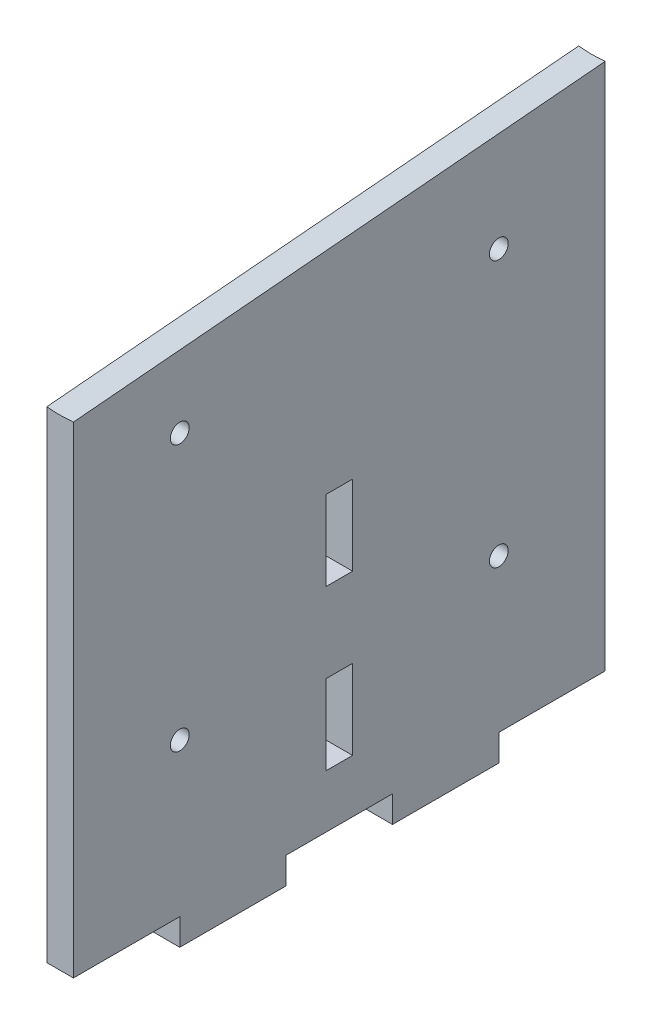
from build123d import *

# Parameters (mm, degrees)
BOSS_EXTRUDE1_OUTLINE_W = 5.08
BOSS_EXTRUDE1_OUTLINE_H = 101.6
BOSS_EXTRUDE1_DEPTH     = 105.948861845
BOSS_EXTRUDE1_START     = 7
BOSS_EXTRUDE1_2_DEPTH   = 104
M3_CLEARANCE_HOLE1_D    = 3.6
SKETCH12_W              = 20.32
SKETCH12_H              = 5.08
CUT_EXTRUDE1_DEPTH      = 147.879296452
SKETCH13_W              = 5.08
SKETCH13_H              = 15.24
CUT_EXTRUDE2_DEPTH      = 147.879296452


with BuildPart() as part:
    # Boss-Extrude1: read off the stored shape, not the designer's step
    # Boss-Extrude1 outline → Boss-Extrude1 (new body)
    with BuildSketch(Plane(origin=(0, 0, 0), x_dir=(1, 0, 0), z_dir=(0, 1, 0))):
        with Locations((2.54, 50.8)):
            Rectangle(BOSS_EXTRUDE1_OUTLINE_W, BOSS_EXTRUDE1_OUTLINE_H)
    extrude(amount=BOSS_EXTRUDE1_DEPTH)

    # Boss-Extrude1 2 outline → Boss-Extrude1 2 (cut)
    with BuildSketch(Plane(origin=(0, 0, 0), x_dir=(1, 0, 0), z_dir=(0, 0.08715574274764448, -0.9961946980917468)).offset(BOSS_EXTRUDE1_START)):
        with BuildLine():
            ThreePointArc((5.08, -96.690670975), (2.54, -96.561403015), (0, -96.690670975))
            Line((0, -96.690670975), (-2, -96.894771203))
            Line((-2, -96.894771203), (-2, -107))
            Line((-2, -107), (7, -107))
            Line((7, -107), (7, -96.886607194))
            Line((7, -96.886607194), (5.08, -96.690670975))
        make_face()
    extrude(amount=BOSS_EXTRUDE1_2_DEPTH, mode=Mode.SUBTRACT)

    # M3 Clearance Hole1 (through all)
    with Locations(Plane(origin=(5.08, 0, 0), x_dir=(0, 0, -1), z_dir=(1, 0, 0))):
        with Locations((81.28, 85.09), (20.32, 85.09), (20.32, 34.29), (81.28, 34.29)):
            Hole(M3_CLEARANCE_HOLE1_D / 2)

    # Sketch12 → Cut-Extrude1 (cut, through all)
    with BuildSketch(Plane(origin=(5.08, 0, 0), x_dir=(0, 0, -1), z_dir=(1, 0, 0))):
        with Locations((91.44, 2.54)):
            Rectangle(SKETCH12_W, SKETCH12_H)
        with Locations((50.8, 2.54)):
            Rectangle(SKETCH12_W, SKETCH12_H)
        with Locations((10.16, 2.54)):
            Rectangle(SKETCH12_W, SKETCH12_H)
    extrude(amount=-CUT_EXTRUDE1_DEPTH, mode=Mode.SUBTRACT)

    # Sketch13 → Cut-Extrude2 (cut, through all)
    with BuildSketch(Plane.ZY):
        with Locations((-50.8, 53.34)):
            Rectangle(SKETCH13_W, SKETCH13_H)
        with Locations((-50.8, 22.86)):
            Rectangle(SKETCH13_W, SKETCH13_H)
    extrude(amount=-CUT_EXTRUDE2_DEPTH, mode=Mode.SUBTRACT)


solid = part.part
